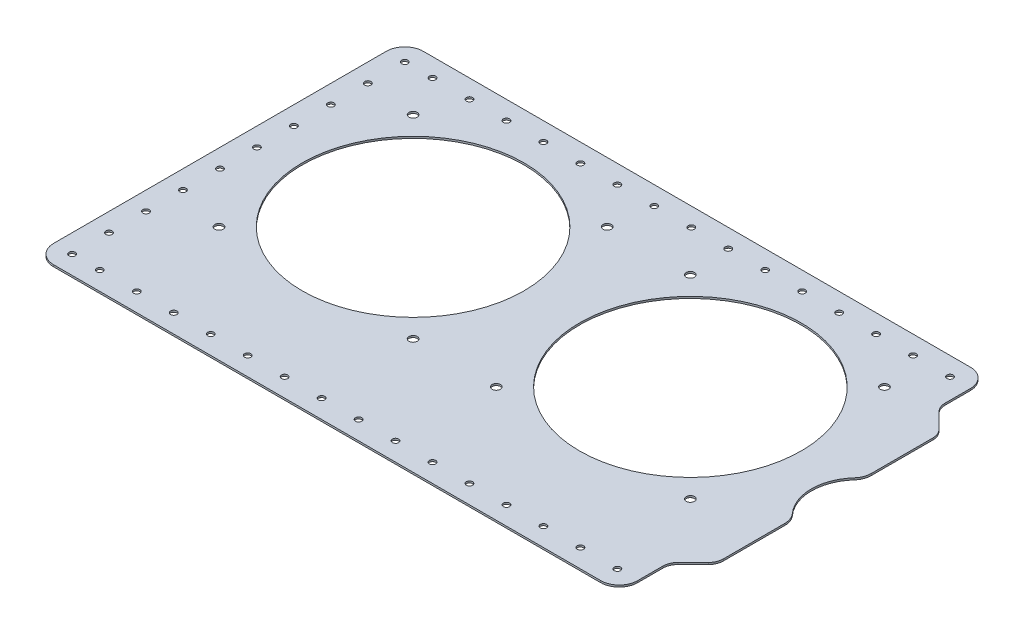
from build123d import *

# Parameters (mm, degrees)
SKETCH1_W                      = 329
SKETCH1_H                      = 200
BOSS_EXTRUDE1_DEPTH            = 1
CUT_EXTRUDE1_DEPTH             = 193.512986575
FILLET1_R                      = 8
FILLET2_R                      = 10
SKETCH3_R                      = 1.7
CUT_EXTRUDE2_DEPTH             = 193.512986575
M3_CLEARANCE_HOLE1_AT_2_COUNT  = 2
M3_CLEARANCE_HOLE1_AT_2_PITCH  = 20
M3_CLEARANCE_HOLE1_AT_3_COUNT  = 2
M3_CLEARANCE_HOLE1_AT_3_PITCH  = 40
M3_CLEARANCE_HOLE1_AT_4_COUNT  = 2
M3_CLEARANCE_HOLE1_AT_4_PITCH  = 60
M3_CLEARANCE_HOLE1_AT_5_COUNT  = 2
M3_CLEARANCE_HOLE1_AT_5_PITCH  = 80
M3_CLEARANCE_HOLE1_AT_6_COUNT  = 2
M3_CLEARANCE_HOLE1_AT_6_PITCH  = 100
M3_CLEARANCE_HOLE1_AT_7_COUNT  = 2
M3_CLEARANCE_HOLE1_AT_7_PITCH  = 120
M3_CLEARANCE_HOLE2_AT_2_COUNT  = 2
M3_CLEARANCE_HOLE2_AT_2_PITCH  = 20
M3_CLEARANCE_HOLE2_AT_3_COUNT  = 2
M3_CLEARANCE_HOLE2_AT_3_PITCH  = 40
M3_CLEARANCE_HOLE2_AT_4_COUNT  = 2
M3_CLEARANCE_HOLE2_AT_4_PITCH  = 60
M3_CLEARANCE_HOLE2_AT_5_COUNT  = 2
M3_CLEARANCE_HOLE2_AT_5_PITCH  = 80
M3_CLEARANCE_HOLE2_AT_6_COUNT  = 2
M3_CLEARANCE_HOLE2_AT_6_PITCH  = 100
M3_CLEARANCE_HOLE2_AT_7_COUNT  = 2
M3_CLEARANCE_HOLE2_AT_7_PITCH  = 120
M3_CLEARANCE_HOLE2_AT_8_COUNT  = 2
M3_CLEARANCE_HOLE2_AT_8_PITCH  = 140
M3_CLEARANCE_HOLE2_AT_9_COUNT  = 2
M3_CLEARANCE_HOLE2_AT_9_PITCH  = 160
M3_CLEARANCE_HOLE2_AT_10_COUNT = 2
M3_CLEARANCE_HOLE2_AT_10_PITCH = 180
M3_CLEARANCE_HOLE2_AT_11_COUNT = 2
M3_CLEARANCE_HOLE2_AT_11_PITCH = 200
M3_CLEARANCE_HOLE2_AT_12_COUNT = 2
M3_CLEARANCE_HOLE2_AT_12_PITCH = 220
M3_CLEARANCE_HOLE2_AT_13_COUNT = 2
M3_CLEARANCE_HOLE2_AT_13_PITCH = 240
M3_CLEARANCE_HOLE2_AT_14_COUNT = 2
M3_CLEARANCE_HOLE2_AT_14_PITCH = 260
M3_CLEARANCE_HOLE2_AT_15_COUNT = 2
M3_CLEARANCE_HOLE2_AT_15_PITCH = 280
M3_CLEARANCE_HOLE2_AT_16_COUNT = 2
M3_CLEARANCE_HOLE2_AT_16_PITCH = 332.866339542
M3_CLEARANCE_HOLE2_AT_17_COUNT = 2
M3_CLEARANCE_HOLE2_AT_17_PITCH = 316.227766017
M3_CLEARANCE_HOLE2_AT_18_COUNT = 2
M3_CLEARANCE_HOLE2_AT_18_PITCH = 300
M3_CLEARANCE_HOLE2_AT_19_COUNT = 2
M3_CLEARANCE_HOLE2_AT_19_PITCH = 284.253408071
M3_CLEARANCE_HOLE2_AT_20_COUNT = 2
M3_CLEARANCE_HOLE2_AT_20_PITCH = 269.072480941
M3_CLEARANCE_HOLE2_AT_21_COUNT = 2
M3_CLEARANCE_HOLE2_AT_21_PITCH = 254.558441227
M3_CLEARANCE_HOLE2_AT_22_COUNT = 2
M3_CLEARANCE_HOLE2_AT_22_PITCH = 240.831891576
M3_CLEARANCE_HOLE2_AT_23_COUNT = 2
M3_CLEARANCE_HOLE2_AT_23_PITCH = 228.03508502
M3_CLEARANCE_HOLE2_AT_24_COUNT = 2
M3_CLEARANCE_HOLE2_AT_24_PITCH = 216.333076528
M3_CLEARANCE_HOLE2_AT_25_COUNT = 2
M3_CLEARANCE_HOLE2_AT_25_PITCH = 205.91260282
M3_CLEARANCE_HOLE2_AT_26_COUNT = 2
M3_CLEARANCE_HOLE2_AT_26_PITCH = 196.977156036
M3_CLEARANCE_HOLE2_AT_27_COUNT = 2
M3_CLEARANCE_HOLE2_AT_27_PITCH = 189.73665961
M3_CLEARANCE_HOLE2_AT_28_COUNT = 2
M3_CLEARANCE_HOLE2_AT_28_PITCH = 184.390889146
M3_CLEARANCE_HOLE2_AT_29_COUNT = 2
M3_CLEARANCE_HOLE2_AT_29_PITCH = 181.107702763
M3_CLEARANCE_HOLE2_AT_30_COUNT = 2
M3_CLEARANCE_HOLE2_AT_30_PITCH = 180
SKETCH9_R                      = 25
CUT_EXTRUDE3_DEPTH             = 10
FILLET3_R                      = 10
M4_CLEARANCE_HOLE1_AT_2_COUNT  = 2
M4_CLEARANCE_HOLE1_AT_2_PITCH  = 183.098334236
M4_CLEARANCE_HOLE1_AT_3_COUNT  = 2
M4_CLEARANCE_HOLE1_AT_3_PITCH  = 255
M4_CLEARANCE_HOLE1_AT_4_COUNT  = 2
M4_CLEARANCE_HOLE1_AT_4_PITCH  = 275.771644663
M4_CLEARANCE_HOLE1_AT_5_COUNT  = 2
M4_CLEARANCE_HOLE1_AT_5_PITCH  = 150
M4_CLEARANCE_HOLE1_AT_6_COUNT  = 2
M4_CLEARANCE_HOLE1_AT_6_PITCH  = 105
M4_CLEARANCE_HOLE1_AT_7_COUNT  = 2
M4_CLEARANCE_HOLE1_AT_7_PITCH  = 148.492424049
M4_CLEARANCE_HOLE1_AT_8_COUNT  = 2
M4_CLEARANCE_HOLE1_AT_8_PITCH  = 105
SKETCH12_R                     = 60
CUT_EXTRUDE4_DEPTH             = 10


with BuildPart() as part:
    # Sketch1 → Boss-Extrude1 (new body)
    with BuildSketch(Plane(origin=(0, 0, 0), x_dir=(1, 0, 0), z_dir=(0, 1, 0))):
        Rectangle(SKETCH1_W, SKETCH1_H)
    extrude(amount=BOSS_EXTRUDE1_DEPTH)

    # Sketch2 → Cut-Extrude1 (cut, through all)
    with BuildSketch(Plane(origin=(0, 0, 0), x_dir=(-1, 0, 0), z_dir=(0, -1, 0))):
        Polygon((-164.5, -60), (-151.5, -73), (-151.5, -100), (-164.5, -100), align=None)
        Polygon((-151.5, 100), (-164.5, 100), (-164.5, 60), (-151.5, 73), align=None)
    extrude(amount=-CUT_EXTRUDE1_DEPTH, mode=Mode.SUBTRACT)

    # Fillet1
    fillet1_edges = [part.edges().sort_by_distance(p)[0] for p in [
        (151.5, 0.5, -73),
        (164.5, 0.5, -60),
        (151.5, 0.5, 73),
        (164.5, 0.5, 60),
    ]]
    fillet(fillet1_edges, radius=FILLET1_R)

    # Fillet2
    fillet2_edges = [part.edges().sort_by_distance(p)[0] for p in [
        (151.5, 0.5, -100),
        (-164.5, 0.5, -100),
        (-164.5, 0.5, 100),
        (151.5, 0.5, 100),
    ]]
    fillet(fillet2_edges, radius=FILLET2_R)

    # Sketch3 → Cut-Extrude2 (cut, through all)
    with BuildSketch(Plane.XZ):
        with Locations((-154.5, -70)):
            Circle(SKETCH3_R)
        with Locations((-154.5, -90)):
            Circle(SKETCH3_R)
        with Locations((-154.5, 70)):
            Circle(SKETCH3_R)
        with Locations((-154.5, 90)):
            Circle(SKETCH3_R)
    extrude(amount=-CUT_EXTRUDE2_DEPTH, mode=Mode.SUBTRACT)

    # Sketch6 → M3 Clearance Hole1 (revolve, cut)
    with BuildSketch(Plane(origin=(-154.5, 0, 70), x_dir=(0, 0, -1), z_dir=(1, 0, 0))):
        Polygon((0, 0), (0, 1), (1.7, 1), (1.7, 0.025), (1.725, 0), align=None)
    m3_clearance_hole1 = revolve(axis=Axis((-154.5, -6.35, 70), (0, 1, 0)), mode=Mode.SUBTRACT)

    # M3 Clearance Hole1 at 2: M3 Clearance Hole1 ×2
    with Locations(*[(0, 0, -i * M3_CLEARANCE_HOLE1_AT_2_PITCH) for i in range(1, M3_CLEARANCE_HOLE1_AT_2_COUNT)]):
        add(m3_clearance_hole1, mode=Mode.SUBTRACT)

    # M3 Clearance Hole1 at 3: M3 Clearance Hole1 ×2
    with Locations(*[(0, 0, -i * M3_CLEARANCE_HOLE1_AT_3_PITCH) for i in range(1, M3_CLEARANCE_HOLE1_AT_3_COUNT)]):
        add(m3_clearance_hole1, mode=Mode.SUBTRACT)

    # M3 Clearance Hole1 at 4: M3 Clearance Hole1 ×2
    with Locations(*[(0, 0, -i * M3_CLEARANCE_HOLE1_AT_4_PITCH) for i in range(1, M3_CLEARANCE_HOLE1_AT_4_COUNT)]):
        add(m3_clearance_hole1, mode=Mode.SUBTRACT)

    # M3 Clearance Hole1 at 5: M3 Clearance Hole1 ×2
    with Locations(*[(0, 0, -i * M3_CLEARANCE_HOLE1_AT_5_PITCH) for i in range(1, M3_CLEARANCE_HOLE1_AT_5_COUNT)]):
        add(m3_clearance_hole1, mode=Mode.SUBTRACT)

    # M3 Clearance Hole1 at 6: M3 Clearance Hole1 ×2
    with Locations(*[(0, 0, -i * M3_CLEARANCE_HOLE1_AT_6_PITCH) for i in range(1, M3_CLEARANCE_HOLE1_AT_6_COUNT)]):
        add(m3_clearance_hole1, mode=Mode.SUBTRACT)

    # M3 Clearance Hole1 at 7: M3 Clearance Hole1 ×2
    with Locations(*[(0, 0, -i * M3_CLEARANCE_HOLE1_AT_7_PITCH) for i in range(1, M3_CLEARANCE_HOLE1_AT_7_COUNT)]):
        add(m3_clearance_hole1, mode=Mode.SUBTRACT)

    # Sketch8 → M3 Clearance Hole2 (revolve, cut)
    with BuildSketch(Plane(origin=(140.5, 0, -90), x_dir=(0, 0, -1), z_dir=(1, 0, 0))):
        Polygon((0, 0), (0, 1), (1.7, 1), (1.7, 0.025), (1.725, 0), align=None)
    m3_clearance_hole2 = revolve(axis=Axis((140.5, -6.35, -90), (0, 1, 0)), mode=Mode.SUBTRACT)

    # M3 Clearance Hole2 at 2: M3 Clearance Hole2 ×2
    with Locations(*[(-i * M3_CLEARANCE_HOLE2_AT_2_PITCH, 0, 0) for i in range(1, M3_CLEARANCE_HOLE2_AT_2_COUNT)]):
        add(m3_clearance_hole2, mode=Mode.SUBTRACT)

    # M3 Clearance Hole2 at 3: M3 Clearance Hole2 ×2
    with Locations(*[(-i * M3_CLEARANCE_HOLE2_AT_3_PITCH, 0, 0) for i in range(1, M3_CLEARANCE_HOLE2_AT_3_COUNT)]):
        add(m3_clearance_hole2, mode=Mode.SUBTRACT)

    # M3 Clearance Hole2 at 4: M3 Clearance Hole2 ×2
    with Locations(*[(-i * M3_CLEARANCE_HOLE2_AT_4_PITCH, 0, 0) for i in range(1, M3_CLEARANCE_HOLE2_AT_4_COUNT)]):
        add(m3_clearance_hole2, mode=Mode.SUBTRACT)

    # M3 Clearance Hole2 at 5: M3 Clearance Hole2 ×2
    with Locations(*[(-i * M3_CLEARANCE_HOLE2_AT_5_PITCH, 0, 0) for i in range(1, M3_CLEARANCE_HOLE2_AT_5_COUNT)]):
        add(m3_clearance_hole2, mode=Mode.SUBTRACT)

    # M3 Clearance Hole2 at 6: M3 Clearance Hole2 ×2
    with Locations(*[(-i * M3_CLEARANCE_HOLE2_AT_6_PITCH, 0, 0) for i in range(1, M3_CLEARANCE_HOLE2_AT_6_COUNT)]):
        add(m3_clearance_hole2, mode=Mode.SUBTRACT)

    # M3 Clearance Hole2 at 7: M3 Clearance Hole2 ×2
    with Locations(*[(-i * M3_CLEARANCE_HOLE2_AT_7_PITCH, 0, 0) for i in range(1, M3_CLEARANCE_HOLE2_AT_7_COUNT)]):
        add(m3_clearance_hole2, mode=Mode.SUBTRACT)

    # M3 Clearance Hole2 at 8: M3 Clearance Hole2 ×2
    with Locations(*[(-i * M3_CLEARANCE_HOLE2_AT_8_PITCH, 0, 0) for i in range(1, M3_CLEARANCE_HOLE2_AT_8_COUNT)]):
        add(m3_clearance_hole2, mode=Mode.SUBTRACT)

    # M3 Clearance Hole2 at 9: M3 Clearance Hole2 ×2
    with Locations(*[(-i * M3_CLEARANCE_HOLE2_AT_9_PITCH, 0, 0) for i in range(1, M3_CLEARANCE_HOLE2_AT_9_COUNT)]):
        add(m3_clearance_hole2, mode=Mode.SUBTRACT)

    # M3 Clearance Hole2 at 10: M3 Clearance Hole2 ×2
    with Locations(*[(-i * M3_CLEARANCE_HOLE2_AT_10_PITCH, 0, 0) for i in range(1, M3_CLEARANCE_HOLE2_AT_10_COUNT)]):
        add(m3_clearance_hole2, mode=Mode.SUBTRACT)

    # M3 Clearance Hole2 at 11: M3 Clearance Hole2 ×2
    with Locations(*[(-i * M3_CLEARANCE_HOLE2_AT_11_PITCH, 0, 0) for i in range(1, M3_CLEARANCE_HOLE2_AT_11_COUNT)]):
        add(m3_clearance_hole2, mode=Mode.SUBTRACT)

    # M3 Clearance Hole2 at 12: M3 Clearance Hole2 ×2
    with Locations(*[(-i * M3_CLEARANCE_HOLE2_AT_12_PITCH, 0, 0) for i in range(1, M3_CLEARANCE_HOLE2_AT_12_COUNT)]):
        add(m3_clearance_hole2, mode=Mode.SUBTRACT)

    # M3 Clearance Hole2 at 13: M3 Clearance Hole2 ×2
    with Locations(*[(-i * M3_CLEARANCE_HOLE2_AT_13_PITCH, 0, 0) for i in range(1, M3_CLEARANCE_HOLE2_AT_13_COUNT)]):
        add(m3_clearance_hole2, mode=Mode.SUBTRACT)

    # M3 Clearance Hole2 at 14: M3 Clearance Hole2 ×2
    with Locations(*[(-i * M3_CLEARANCE_HOLE2_AT_14_PITCH, 0, 0) for i in range(1, M3_CLEARANCE_HOLE2_AT_14_COUNT)]):
        add(m3_clearance_hole2, mode=Mode.SUBTRACT)

    # M3 Clearance Hole2 at 15: M3 Clearance Hole2 ×2
    with Locations(*[(-i * M3_CLEARANCE_HOLE2_AT_15_PITCH, 0, 0) for i in range(1, M3_CLEARANCE_HOLE2_AT_15_COUNT)]):
        add(m3_clearance_hole2, mode=Mode.SUBTRACT)

    # M3 Clearance Hole2 at 16: M3 Clearance Hole2 ×2
    with Locations(*[Vector(-0.8411784753765535, 0, 0.5407575913134988) * (i * M3_CLEARANCE_HOLE2_AT_16_PITCH) for i in range(1, M3_CLEARANCE_HOLE2_AT_16_COUNT)]):
        add(m3_clearance_hole2, mode=Mode.SUBTRACT)

    # M3 Clearance Hole2 at 17: M3 Clearance Hole2 ×2
    with Locations(*[Vector(-0.8221921916437787, 0, 0.5692099788303084) * (i * M3_CLEARANCE_HOLE2_AT_17_PITCH) for i in range(1, M3_CLEARANCE_HOLE2_AT_17_COUNT)]):
        add(m3_clearance_hole2, mode=Mode.SUBTRACT)

    # M3 Clearance Hole2 at 18: M3 Clearance Hole2 ×2
    with Locations(*[Vector(-0.8, 0, 0.6000000000000001) * (i * M3_CLEARANCE_HOLE2_AT_18_PITCH) for i in range(1, M3_CLEARANCE_HOLE2_AT_18_COUNT)]):
        add(m3_clearance_hole2, mode=Mode.SUBTRACT)

    # M3 Clearance Hole2 at 19: M3 Clearance Hole2 ×2
    with Locations(*[Vector(-0.773957299203321, 0, 0.6332377902572627) * (i * M3_CLEARANCE_HOLE2_AT_19_PITCH) for i in range(1, M3_CLEARANCE_HOLE2_AT_19_COUNT)]):
        add(m3_clearance_hole2, mode=Mode.SUBTRACT)

    # M3 Clearance Hole2 at 20: M3 Clearance Hole2 ×2
    with Locations(*[Vector(-0.7432941462471663, 0, 0.6689647316224497) * (i * M3_CLEARANCE_HOLE2_AT_20_PITCH) for i in range(1, M3_CLEARANCE_HOLE2_AT_20_COUNT)]):
        add(m3_clearance_hole2, mode=Mode.SUBTRACT)

    # M3 Clearance Hole2 at 21: M3 Clearance Hole2 ×2
    with Locations(*[Vector(-0.7071067811865475, 0, 0.7071067811865476) * (i * M3_CLEARANCE_HOLE2_AT_21_PITCH) for i in range(1, M3_CLEARANCE_HOLE2_AT_21_COUNT)]):
        add(m3_clearance_hole2, mode=Mode.SUBTRACT)

    # M3 Clearance Hole2 at 22: M3 Clearance Hole2 ×2
    with Locations(*[Vector(-0.6643638388299197, 0, 0.7474093186836598) * (i * M3_CLEARANCE_HOLE2_AT_22_PITCH) for i in range(1, M3_CLEARANCE_HOLE2_AT_22_COUNT)]):
        add(m3_clearance_hole2, mode=Mode.SUBTRACT)

    # M3 Clearance Hole2 at 23: M3 Clearance Hole2 ×2
    with Locations(*[Vector(-0.6139406135149205, 0, 0.7893522173763263) * (i * M3_CLEARANCE_HOLE2_AT_23_PITCH) for i in range(1, M3_CLEARANCE_HOLE2_AT_23_COUNT)]):
        add(m3_clearance_hole2, mode=Mode.SUBTRACT)

    # M3 Clearance Hole2 at 24: M3 Clearance Hole2 ×2
    with Locations(*[Vector(-0.554700196225229, 0, 0.8320502943378437) * (i * M3_CLEARANCE_HOLE2_AT_24_PITCH) for i in range(1, M3_CLEARANCE_HOLE2_AT_24_COUNT)]):
        add(m3_clearance_hole2, mode=Mode.SUBTRACT)

    # M3 Clearance Hole2 at 25: M3 Clearance Hole2 ×2
    with Locations(*[Vector(-0.48564293117863216, 0, 0.8741572761215377) * (i * M3_CLEARANCE_HOLE2_AT_25_PITCH) for i in range(1, M3_CLEARANCE_HOLE2_AT_25_COUNT)]):
        add(m3_clearance_hole2, mode=Mode.SUBTRACT)

    # M3 Clearance Hole2 at 26: M3 Clearance Hole2 ×2
    with Locations(*[Vector(-0.4061384660534476, 0, 0.9138115486202572) * (i * M3_CLEARANCE_HOLE2_AT_26_PITCH) for i in range(1, M3_CLEARANCE_HOLE2_AT_26_COUNT)]):
        add(m3_clearance_hole2, mode=Mode.SUBTRACT)

    # M3 Clearance Hole2 at 27: M3 Clearance Hole2 ×2
    with Locations(*[Vector(-0.316227766016838, 0, 0.9486832980505139) * (i * M3_CLEARANCE_HOLE2_AT_27_PITCH) for i in range(1, M3_CLEARANCE_HOLE2_AT_27_COUNT)]):
        add(m3_clearance_hole2, mode=Mode.SUBTRACT)

    # M3 Clearance Hole2 at 28: M3 Clearance Hole2 ×2
    with Locations(*[Vector(-0.2169304578186562, 0, 0.9761870601839527) * (i * M3_CLEARANCE_HOLE2_AT_28_PITCH) for i in range(1, M3_CLEARANCE_HOLE2_AT_28_COUNT)]):
        add(m3_clearance_hole2, mode=Mode.SUBTRACT)

    # M3 Clearance Hole2 at 29: M3 Clearance Hole2 ×2
    with Locations(*[Vector(-0.11043152607484662, 0, 0.9938837346736189) * (i * M3_CLEARANCE_HOLE2_AT_29_PITCH) for i in range(1, M3_CLEARANCE_HOLE2_AT_29_COUNT)]):
        add(m3_clearance_hole2, mode=Mode.SUBTRACT)

    # M3 Clearance Hole2 at 30: M3 Clearance Hole2 ×2
    with Locations(*[(0, 0, i * M3_CLEARANCE_HOLE2_AT_30_PITCH) for i in range(1, M3_CLEARANCE_HOLE2_AT_30_COUNT)]):
        add(m3_clearance_hole2, mode=Mode.SUBTRACT)

    # Sketch9 → Cut-Extrude3 (cut)
    with BuildSketch(Plane(origin=(0, 0, 0), x_dir=(-1, 0, 0), z_dir=(0, -1, 0))):
        with Locations((-180.5, 0)):
            Circle(SKETCH9_R)
    extrude(amount=-CUT_EXTRUDE3_DEPTH, mode=Mode.SUBTRACT)

    # Fillet3
    fillet3_edges = [part.edges().sort_by_distance(p)[0] for p in [
        (164.5, 0.5, -19.209372712),
        (164.5, 0.5, 19.209372712),
    ]]
    fillet(fillet3_edges, radius=FILLET3_R)

    # Sketch11 → M4 Clearance Hole1 (revolve, cut)
    with BuildSketch(Plane(origin=(127.5, 0, 37.5), x_dir=(0, 0, -1), z_dir=(1, 0, 0))):
        Polygon((0, 0), (0, 1), (2.25, 1), (2.25, 0.025), (2.275, 0), align=None)
    m4_clearance_hole1 = revolve(axis=Axis((127.5, -6.35, 37.5), (0, 1, 0)), mode=Mode.SUBTRACT)

    # M4 Clearance Hole1 at 2: M4 Clearance Hole1 ×2
    with Locations(*[Vector(-0.8192319205190406, 0, -0.5734623443633282) * (i * M4_CLEARANCE_HOLE1_AT_2_PITCH) for i in range(1, M4_CLEARANCE_HOLE1_AT_2_COUNT)]):
        add(m4_clearance_hole1, mode=Mode.SUBTRACT)

    # M4 Clearance Hole1 at 3: M4 Clearance Hole1 ×2
    with Locations(*[(-i * M4_CLEARANCE_HOLE1_AT_3_PITCH, 0, 0) for i in range(1, M4_CLEARANCE_HOLE1_AT_3_COUNT)]):
        add(m4_clearance_hole1, mode=Mode.SUBTRACT)

    # M4 Clearance Hole1 at 4: M4 Clearance Hole1 ×2
    with Locations(*[Vector(-0.924678098474716, 0, -0.3807498052542948) * (i * M4_CLEARANCE_HOLE1_AT_4_PITCH) for i in range(1, M4_CLEARANCE_HOLE1_AT_4_COUNT)]):
        add(m4_clearance_hole1, mode=Mode.SUBTRACT)

    # M4 Clearance Hole1 at 5: M4 Clearance Hole1 ×2
    with Locations(*[(-i * M4_CLEARANCE_HOLE1_AT_5_PITCH, 0, 0) for i in range(1, M4_CLEARANCE_HOLE1_AT_5_COUNT)]):
        add(m4_clearance_hole1, mode=Mode.SUBTRACT)

    # M4 Clearance Hole1 at 6: M4 Clearance Hole1 ×2
    with Locations(*[(0, 0, -i * M4_CLEARANCE_HOLE1_AT_6_PITCH) for i in range(1, M4_CLEARANCE_HOLE1_AT_6_COUNT)]):
        add(m4_clearance_hole1, mode=Mode.SUBTRACT)

    # M4 Clearance Hole1 at 7: M4 Clearance Hole1 ×2
    with Locations(*[Vector(-0.7071067811865477, 0, -0.7071067811865475) * (i * M4_CLEARANCE_HOLE1_AT_7_PITCH) for i in range(1, M4_CLEARANCE_HOLE1_AT_7_COUNT)]):
        add(m4_clearance_hole1, mode=Mode.SUBTRACT)

    # M4 Clearance Hole1 at 8: M4 Clearance Hole1 ×2
    with Locations(*[(-i * M4_CLEARANCE_HOLE1_AT_8_PITCH, 0, 0) for i in range(1, M4_CLEARANCE_HOLE1_AT_8_COUNT)]):
        add(m4_clearance_hole1, mode=Mode.SUBTRACT)

    # Sketch12 → Cut-Extrude4 (cut)
    with BuildSketch(Plane(origin=(0, 0, 0), x_dir=(-1, 0, 0), z_dir=(0, -1, 0))):
        with Locations((75, 15)):
            Circle(SKETCH12_R)
        with Locations((-75, 15)):
            Circle(SKETCH12_R)
    extrude(amount=-CUT_EXTRUDE4_DEPTH, mode=Mode.SUBTRACT)


solid = part.part
